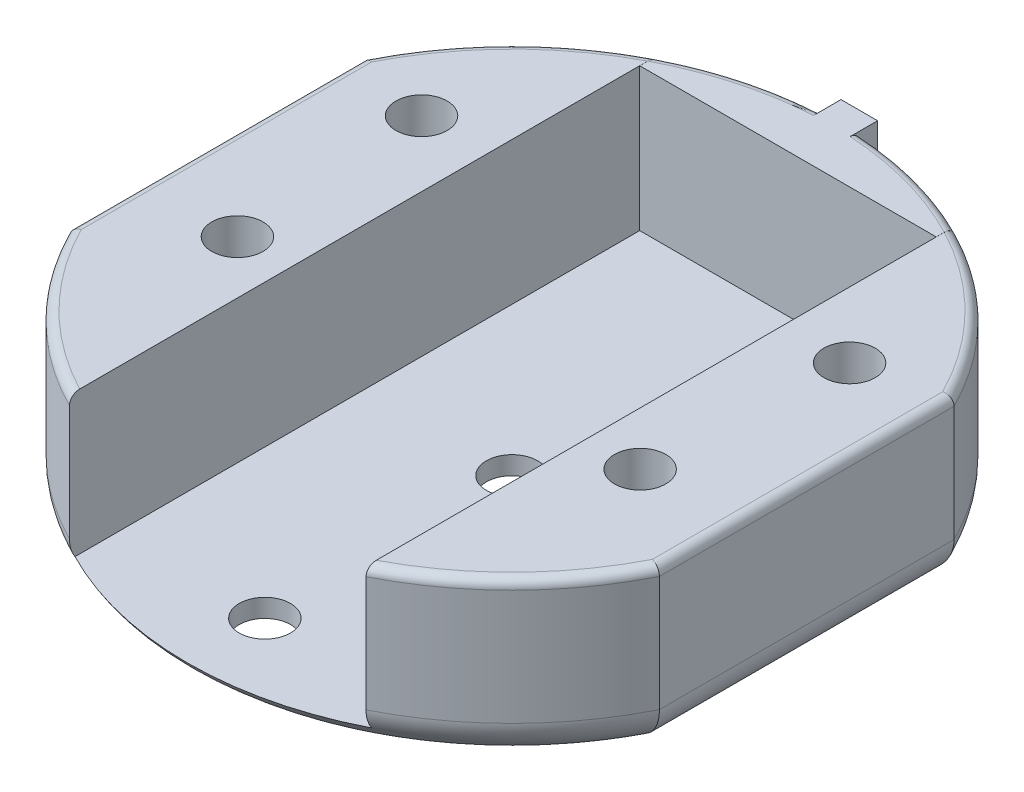
from build123d import *

# Parameters (mm, degrees)
BOSS_EXTRUDE1_DEPTH      = 1
BOSS_EXTRUDE2_DEPTH      = 18
BOSS_EXTRUDE2_DEPTH_BACK = 18.972201
SKETCH3_R                = 59.910539196270584
CUT_EXTRUDE1_DEPTH       = 28.593195008632154
CUT_EXTRUDE2_DEPTH       = 28.59319484059837
CUT_EXTRUDE2_DEPTH_BACK  = 28.59319484059837
SKETCH5_R                = 1.4
SKETCH5_R_2              = 1.3999999999999992
SKETCH5_R_3              = 1.400000000000003
SKETCH5_R_4              = 1.3999999999999988
SKETCH5_R_5              = 1.399999999999999
BOSS_EXTRUDE3_DEPTH      = 8.8
CUT_EXTRUDE3_DEPTH       = 28.290738383400775
FILLET1_R                = 2
FILLET2_R                = 0.5


with BuildPart() as part:
    # Sketch1 → Boss-Extrude1 (new body)
    with BuildSketch(Plane(origin=(0, 0, 0), x_dir=(1, 0, 0), z_dir=(0, 1, 0))):
        with BuildLine():
            Line((-1.0000000000000024, 17.97220075561143), (-1.0000000000000024, 18.97220075561143))
            Line((-1.0000000000000024, 18.97220075561143), (0.9999999999999977, 18.97220075561143))
            Line((0.9999999999999977, 18.97220075561143), (0.9999999999999981, 17.97220075561143))
            ThreePointArc((0.9999999999999981, 17.97220075561143), (-3.31e-15, -18), (-1.0000000000000024, 17.97220075561143))
        make_face()
    extrude(amount=BOSS_EXTRUDE1_DEPTH)

    # Sketch2 → Boss-Extrude2 (add, two sides: drawn at the far end of the back side and taken through both)
    with BuildSketch(Plane.XY.offset(-BOSS_EXTRUDE2_DEPTH_BACK)):
        Polygon((-16.1, 8.799999999999999), (-8.100000000000005, 8.799999999999999), (-8.099999999999996, 1), (-16.099999999999998, 1), align=None)
        Polygon((8.099999999999994, 8.799999999999999), (16.099999999999994, 8.799999999999999), (16.100000000000005, 1), (8.100000000000003, 0.9999999999999991), align=None)
    extrude(amount=BOSS_EXTRUDE2_DEPTH + BOSS_EXTRUDE2_DEPTH_BACK)

    # Sketch3 → Cut-Extrude1 (cut, through all)
    with BuildSketch(Plane.XZ):
        Circle(SKETCH3_R)
        with BuildLine():
            Line((-1.000000000000015, -17.97220075561143), (-1.0000000000000024, -18.97220075561143))
            Line((-1.0000000000000024, -18.97220075561143), (0.9999999999999977, -18.97220075561143))
            Line((0.9999999999999977, -18.97220075561143), (0.9999999999999927, -17.972200755611432))
            ThreePointArc((0.9999999999999927, -17.972200755611432), (1.309e-14, 18.000000000000004), (-1.000000000000015, -17.97220075561143))
        make_face(mode=Mode.SUBTRACT)
    extrude(amount=-CUT_EXTRUDE1_DEPTH, mode=Mode.SUBTRACT)

    # Sketch5 → Cut-Extrude2 (cut, two sides: drawn at the far end of the back side and taken through both)
    with BuildSketch(Plane(origin=(0, 0, 0), x_dir=(1, 0, 0), z_dir=(0, 1, 0)).offset(-CUT_EXTRUDE2_DEPTH_BACK)):
        with Locations(Location((0, 0, 0), (0, 0, 180))):
            Circle(SKETCH5_R)
        with Locations(Location((11, -4, 0), (0, 0, 180))):
            Circle(SKETCH5_R_2)
        with Locations(Location((-11, -4, 0), (0, 0, 180))):
            Circle(SKETCH5_R_2)
        with Locations(Location((-11.69134295108996, 6.749999999999895, 0), (0, 0, 180))):
            Circle(SKETCH5_R_3)
        with Locations(Location((1.197e-13, -13.499999999999998, 0), (0, 0, 180))):
            Circle(SKETCH5_R_4)
        with Locations(Location((11.691342951089881, 6.750000000000103, 0), (0, 0, 180))):
            Circle(SKETCH5_R_5)
    extrude(amount=CUT_EXTRUDE2_DEPTH + CUT_EXTRUDE2_DEPTH_BACK, mode=Mode.SUBTRACT)

    # Sketch6 → Boss-Extrude3 (add)
    with BuildSketch(Plane.XZ):
        with BuildLine():
            Line((-8.097530487747482, -15.075758146973973), (8.097530487747482, -15.075758146973973))
            Line((8.097530487747482, -15.075758146973973), (8.09753048774748, -16.075758146973975))
            ThreePointArc((8.09753048774748, -16.075758146973975), (4.646545909149893, -17.38992843901787), (0.9999999999999927, -17.972200755611432))
            Line((0.9999999999999927, -17.972200755611432), (0.9999999999999977, -18.97220075561143))
            Line((0.9999999999999977, -18.97220075561143), (-1.0000000000000024, -18.97220075561143))
            Line((-1.0000000000000024, -18.97220075561143), (-1.000000000000015, -17.97220075561143))
            ThreePointArc((-1.000000000000015, -17.97220075561143), (-4.646545909149902, -17.38992843901787), (-8.097530487747482, -16.075758146973975))
            Line((-8.097530487747482, -16.075758146973975), (-8.097530487747482, -15.075758146973973))
        make_face()
    extrude(amount=-BOSS_EXTRUDE3_DEPTH)

    # Sketch7 → Cut-Extrude3 (cut, through all)
    with BuildSketch(Plane(origin=(0, 1, 0), x_dir=(1, 0, 0), z_dir=(0, 1, 0))):
        with BuildLine():
            Line((16.099999999999994, 8.049223565040313), (16.099999999999994, -8.049223565040313))
            ThreePointArc((16.099999999999994, -8.049223565040313), (18.000000000000004, 0), (16.099999999999994, 8.049223565040313))
        make_face()
        with BuildLine():
            Line((-16.099999999999998, -8.049223565040306), (-16.099999999999998, 8.049223565040306))
            ThreePointArc((-16.099999999999998, 8.049223565040306), (-18.000000000000004, 2.2e-15), (-16.099999999999998, -8.049223565040306))
        make_face()
    extrude(amount=-CUT_EXTRUDE3_DEPTH, mode=Mode.SUBTRACT)

    # Fillet1
    # the kernel refuses this fillet: 2 mm, written as the material it takes off along each edge
    with BuildSketch(Plane(origin=(-3.872e-14, 0, -5.4e-16), x_dir=(0.9828239646934485, 0, 0.1845455348260998), z_dir=(0.1845455348260998, 0, -0.9828239646934485))) as fillet1_piece_1:
        with BuildLine():
            CenterArc((17.999999999999872 - FILLET1_R, -FILLET1_R), FILLET1_R, 6.36e-15, 90)
            Line((17.999999999999872, -FILLET1_R), (17.999999999999872, 0))
            Line((17.999999999999872, 0), (17.999999999999872 - FILLET1_R, 0))
        make_face()
    revolve(axis=Axis((-3.872e-14, 0, -5.4e-16), (0, -1, 0)), revolution_arc=158.7307255035683, mode=Mode.SUBTRACT)
    with BuildSketch(Plane(origin=(-3.872e-14, 0, -5.4e-16), x_dir=(0.4498628048748618, 0, -0.8930976748318865), z_dir=(-0.8930976748318865, 0, -0.4498628048748618))) as fillet1_piece_2:
        with BuildLine():
            CenterArc((18.000000000000004 - FILLET1_R, -FILLET1_R), FILLET1_R, 6.36e-15, 90)
            Line((18.000000000000007, -FILLET1_R), (18.000000000000004, 0))
            Line((18.000000000000004, 0), (18.000000000000004 - FILLET1_R, 0))
        make_face()
    revolve(axis=Axis((-3.872e-14, 0, -5.4e-16), (0, -1, 0)), revolution_arc=52.61883467829079, mode=Mode.SUBTRACT)
    with BuildSketch(Plane(origin=(16.099999999999994, 0, 13.049223565040313), x_dir=(-1, 0, 0), z_dir=(0, 0, -1))) as fillet1_piece_3:
        with BuildLine():
            CenterArc((FILLET1_R, FILLET1_R), FILLET1_R, 180, 90)
            Line((0, FILLET1_R), (0, 0))
            Line((0, 0), (FILLET1_R, 0))
        make_face()
    extrude(amount=26.098447130080626, mode=Mode.SUBTRACT)
    with BuildSketch(Plane(origin=(-16.099999999999998, 0, -13.049223565040311), x_dir=(1, 0, 0), z_dir=(0, 0, 1))) as fillet1_piece_4:
        with BuildLine():
            CenterArc((FILLET1_R, FILLET1_R), FILLET1_R, 180, 90)
            Line((0, FILLET1_R), (0, 0))
            Line((0, 0), (FILLET1_R, 0))
        make_face()
    extrude(amount=26.098447130080615, mode=Mode.SUBTRACT)
    with BuildSketch(Plane(origin=(-3.872e-14, 0, -5.4e-16), x_dir=(-0.9827864332200049, 0, -0.18474530218303542), z_dir=(-0.18474530218303542, 0, 0.9827864332200049))) as fillet1_piece_5:
        with BuildLine():
            CenterArc((18.000000000000007 - FILLET1_R, -FILLET1_R), FILLET1_R, 0, 90)
            Line((18.000000000000007 - FILLET1_R, 2.2e-16), (18.000000000000007, 0))
            Line((18.000000000000007, 0), (18.000000000000007, -FILLET1_R))
        make_face()
    revolve(axis=Axis((-3.872e-14, 0, -5.4e-16), (0, -1, 0)), revolution_arc=52.61883467829094, mode=Mode.SUBTRACT)
    with BuildSketch(Plane(origin=(-3.872e-14, 0, -5.4e-16), x_dir=(-0.44986280487485913, 0, -0.8930976748318878), z_dir=(-0.8930976748318878, 0, 0.44986280487485913))) as fillet1_piece_6_section:
        with BuildLine():
            CenterArc((18 - FILLET1_R, -FILLET1_R), FILLET1_R, 0, 89.9999999999999)
            Line((18 - FILLET1_R, 2.2e-16), (18, 0))
            Line((18, 0), (18, -FILLET1_R))
        make_face()
    fillet1_piece_6 = revolve(axis=Axis((-3.872e-14, 0, -5.4e-16), (0, -1, 0)), revolution_arc=39.46607540970417, mode=Mode.PRIVATE)
    fillet1_piece_6 = split(fillet1_piece_6, bisect_by=Plane(origin=(-1.0000000000000024, 0.45992141450225776, -16.842636156243355), z_dir=(-1, 0, 0)), keep=Keep.TOP, mode=Mode.PRIVATE)
    add(fillet1_piece_6, mode=Mode.SUBTRACT)
    with BuildSketch(Plane(origin=(-3.872e-14, 0, -5.4e-16), x_dir=(-0.44986280487485913, 0, -0.8930976748318878), z_dir=(-0.8930976748318878, 0, 0.44986280487485913))) as fillet1_piece_7_section:
        with BuildLine():
            CenterArc((18 - FILLET1_R, -FILLET1_R), FILLET1_R, 0, 89.9999999999999)
            Line((18 - FILLET1_R, 2.2e-16), (18, 0))
            Line((18, 0), (18, -FILLET1_R))
        make_face()
    fillet1_piece_7 = revolve(axis=Axis((-3.872e-14, 0, -5.4e-16), (0, -1, 0)), revolution_arc=39.46607540970417, mode=Mode.PRIVATE)
    fillet1_piece_7 = split(fillet1_piece_7, bisect_by=Plane(origin=(0.9999999999999897, 0.4612121351403519, -17.37087292856804), z_dir=(1, 0, 5e-15)), keep=Keep.TOP, mode=Mode.PRIVATE)
    add(fillet1_piece_7, mode=Mode.SUBTRACT)
    with BuildSketch(Plane(origin=(-3.872e-14, 0, -5.4e-16), x_dir=(-0.22037727986092012, 0, -0.9754147089936167), z_dir=(-0.9754147089936167, 0, 0.22037727986092012))) as fillet1_piece_8_section:
        with BuildLine():
            CenterArc((18.000000000000014 - FILLET1_R, -FILLET1_R), FILLET1_R, 1.272e-14, 90)
            Line((18.000000000000014, -FILLET1_R), (18.000000000000014, 0))
            Line((18.000000000000014, 0), (18.000000000000014 - FILLET1_R, 0))
        make_face()
    fillet1_piece_8 = revolve(axis=Axis((-3.872e-14, 0, -5.4e-16), (0, -1, 0)), revolution_arc=39.46607540970416, mode=Mode.PRIVATE)
    fillet1_piece_8 = split(fillet1_piece_8, bisect_by=Plane(origin=(-1.0000000000000024, 0.4612120759147971, -17.37087269742329), z_dir=(-1, 0, 0)), keep=Keep.TOP, mode=Mode.PRIVATE)
    add(fillet1_piece_8, mode=Mode.SUBTRACT)
    with BuildSketch(Plane(origin=(-3.872e-14, 0, -5.4e-16), x_dir=(-0.22037727986092012, 0, -0.9754147089936167), z_dir=(-0.9754147089936167, 0, 0.22037727986092012))) as fillet1_piece_9_section:
        with BuildLine():
            CenterArc((18.000000000000014 - FILLET1_R, -FILLET1_R), FILLET1_R, 1.272e-14, 90)
            Line((18.000000000000014, -FILLET1_R), (18.000000000000014, 0))
            Line((18.000000000000014, 0), (18.000000000000014 - FILLET1_R, 0))
        make_face()
    fillet1_piece_9 = revolve(axis=Axis((-3.872e-14, 0, -5.4e-16), (0, -1, 0)), revolution_arc=39.46607540970416, mode=Mode.PRIVATE)
    fillet1_piece_9 = split(fillet1_piece_9, bisect_by=Plane(origin=(0.999999999999987, 0.4599214469726478, -16.84263631620444), z_dir=(1, 0, 5e-15)), keep=Keep.TOP, mode=Mode.PRIVATE)
    add(fillet1_piece_9, mode=Mode.SUBTRACT)

    # Fillet2
    fillet2_edges = [part.edges().sort_by_distance(p)[0] for p in [
        (4.646545909149891, 8.8, -17.38992843901787),
        (-4.646545909149905, 8.8, -17.389928439017865),
        (16.099999999999994, 8.799999999999999, 0),
        (-16.1, 8.799999999999999, 0),
        (-12.747992845911156, 8.799999999999999, 12.70781957696123),
        (-12.747992845911165, 8.799999999999999, -12.707819576961219),
        (12.747992845911162, 8.799999999999999, 12.707819576961153),
        (12.74799284591116, 8.799999999999999, -12.707819576961155),
    ]]
    fillet(fillet2_edges, radius=FILLET2_R)


solid = part.part
